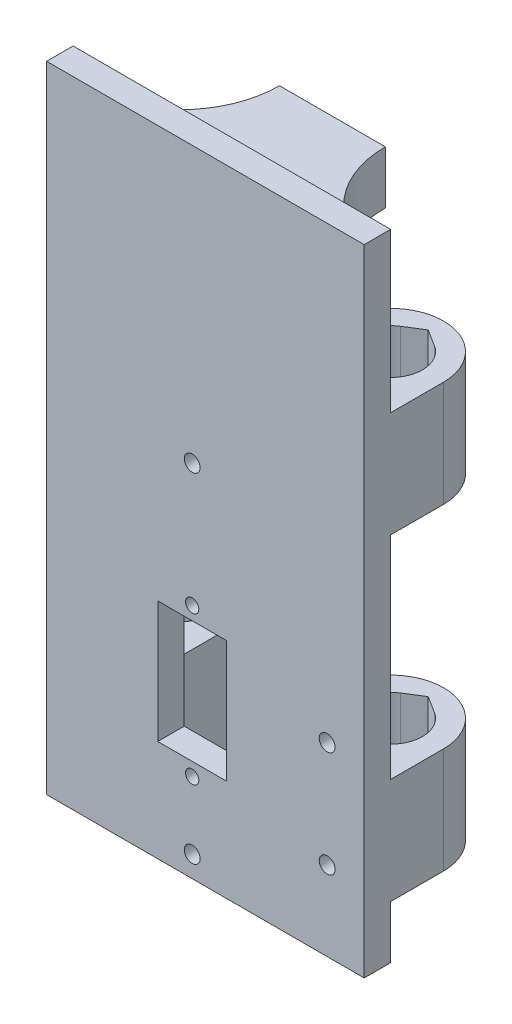
from build123d import *

# Parameters (mm, degrees)
SKETCH1_W           = 60
SKETCH1_H           = 120
SKETCH1_R           = 1.5
SKETCH1_R_2         = 1.25
SKETCH1_W_2         = 13
SKETCH1_H_2         = 23
BOSS_EXTRUDE1_DEPTH = 5
SKETCH2_W           = 20
SKETCH2_H           = 20
BOSS_EXTRUDE2_DEPTH = 20
CUT_EXTRUDE1_DEPTH  = 116.758369028
FILLET1_R           = 10
SKETCH4_W           = 60
SKETCH4_H           = 10
BOSS_EXTRUDE3_DEPTH = 19
CUT_EXTRUDE2_DEPTH  = 10
FILLET2_R           = 3


with BuildPart() as part:
    # Sketch1 → Boss-Extrude1 (new body)
    with BuildSketch(Plane.XY):
        Rectangle(SKETCH1_W, SKETCH1_H)
        with Locations((23, -25)):
            Circle(SKETCH1_R, mode=Mode.SUBTRACT)
        with Locations((23, -45)):
            Circle(SKETCH1_R, mode=Mode.SUBTRACT)
        with Locations((-2.5, -56)):
            Circle(SKETCH1_R, mode=Mode.SUBTRACT)
        with Locations((-2.5, 8)):
            Circle(SKETCH1_R, mode=Mode.SUBTRACT)
        with Locations((-2.5, -15.3)):
            Circle(SKETCH1_R_2, mode=Mode.SUBTRACT)
        with Locations((-2.5, -43.3)):
            Circle(SKETCH1_R_2, mode=Mode.SUBTRACT)
        with Locations((-2.5, -29.3)):
            Rectangle(SKETCH1_W_2, SKETCH1_H_2, mode=Mode.SUBTRACT)
    extrude(amount=BOSS_EXTRUDE1_DEPTH)

    # Sketch2 → Boss-Extrude2 (add)
    with BuildSketch(Plane(origin=(0, 0, 0), x_dir=(-1, 0, 0), z_dir=(0, 0, -1))):
        with Locations((-20, -40)):
            Rectangle(SKETCH2_W, SKETCH2_H)
        with Locations((20, -40)):
            Rectangle(SKETCH2_W, SKETCH2_H)
        with Locations((20, 20)):
            Rectangle(SKETCH2_W, SKETCH2_H)
        with Locations((-20, 20)):
            Rectangle(SKETCH2_W, SKETCH2_H)
    extrude(amount=BOSS_EXTRUDE2_DEPTH)

    # Sketch3 → Cut-Extrude1 (cut, through all)
    with BuildSketch(Plane.XZ.offset(50)):
        with BuildLine():
            Line((-23.188342055, -15.08276253), (-20, -17.08276253))
            Line((-20, -17.08276253), (-16.811657945, -15.08276253))
            ThreePointArc((-16.811657945, -15.08276253), (-20, -4), (-23.188342055, -15.08276253))
        make_face()
        with BuildLine():
            Line((20, -17.08276253), (16.811657945, -15.08276253))
            ThreePointArc((16.811657945, -15.08276253), (20, -4), (23.188342055, -15.08276253))
            Line((23.188342055, -15.08276253), (20, -17.08276253))
        make_face()
    extrude(amount=-CUT_EXTRUDE1_DEPTH, mode=Mode.SUBTRACT)

    # Fillet1
    fillet1_edges = [part.edges().sort_by_distance(p)[0] for p in [
        (-10, -40, -20),
        (-30, -40, -20),
        (-30, 20, -20),
        (-10, 20, -20),
        (30, 20, -20),
        (10, 20, -20),
        (10, -40, -20),
        (30, -40, -20),
    ]]
    fillet(fillet1_edges, radius=FILLET1_R - 0.0001)  # a hair under: the kernel refuses the full size

    # Sketch4 → Boss-Extrude3 (add)
    with BuildSketch(Plane(origin=(0, 0, 0), x_dir=(-1, 0, 0), z_dir=(0, 0, -1))):
        with Locations((0, 49)):
            Rectangle(SKETCH4_W, SKETCH4_H)
    extrude(amount=BOSS_EXTRUDE3_DEPTH)

    # Sketch5 → Cut-Extrude2 (cut)
    with BuildSketch(Plane(origin=(0, 54, 0), x_dir=(1, 0, 0), z_dir=(0, 1, 0))):
        with BuildLine():
            Line((-10, 19), (-30, 19))
            Line((-30, 19), (-30, 0))
            ThreePointArc((-30, 0), (-15.921541487, 5.206885776), (-10, 19))
        make_face()
        with BuildLine():
            Line((10, 19), (30, 19))
            Line((30, 19), (30, 0))
            ThreePointArc((30, 0), (15.921541487, 5.206885776), (10, 19))
        make_face()
    extrude(amount=-CUT_EXTRUDE2_DEPTH, mode=Mode.SUBTRACT)

    # Fillet2
    fillet2_edges = [part.edges().sort_by_distance(p)[0] for p in [
        (0, 44, 0),
        (0, 54, 0),
    ]]
    fillet(fillet2_edges, radius=FILLET2_R)


solid = part.part
